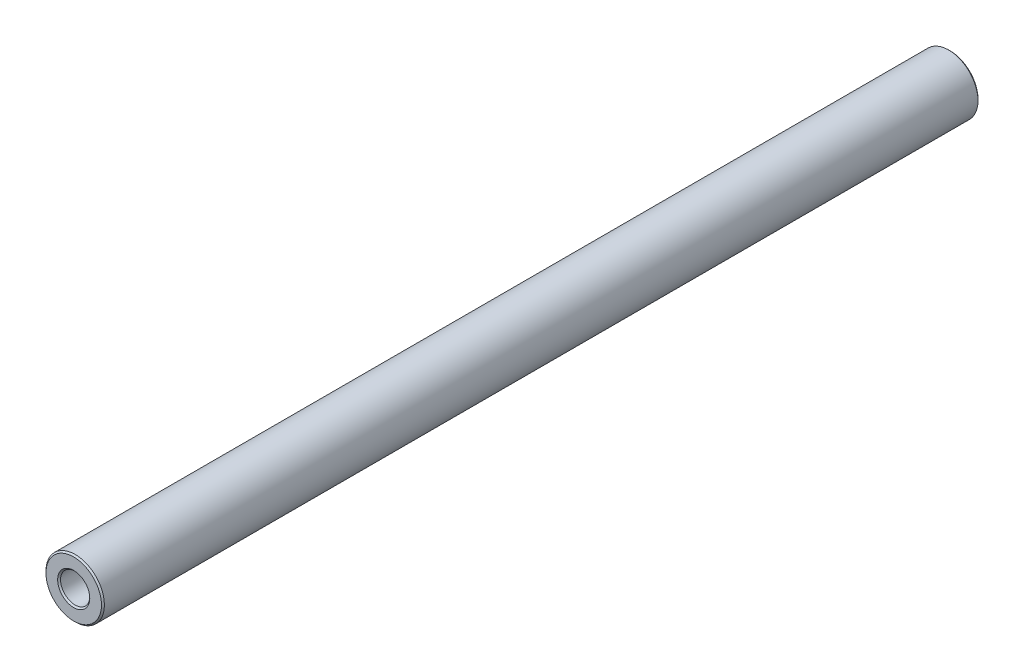
from build123d import *

# Parameters (mm, degrees)
SKETCH1_R           = 5
SKETCH1_R_2         = 2.5
BOSS_EXTRUDE1_DEPTH = 75
CHAMFER1_SIZE       = 0.25


with BuildPart() as part:
    # Sketch1 → Boss-Extrude1 (new, symmetric)
    with BuildSketch(Plane.XY):
        Circle(SKETCH1_R)
        Circle(SKETCH1_R_2, mode=Mode.SUBTRACT)
    extrude(amount=BOSS_EXTRUDE1_DEPTH, both=True)

    # Chamfer1
    chamfer1_edges = [part.edges().sort_by_distance(p)[0] for p in [
        (-2.5, 0, -75),
        (-2.5, 0, 75),
        (-5, 0, -75),
        (-5, 0, 75),
    ]]
    chamfer(chamfer1_edges, length=CHAMFER1_SIZE)


solid = part.part
